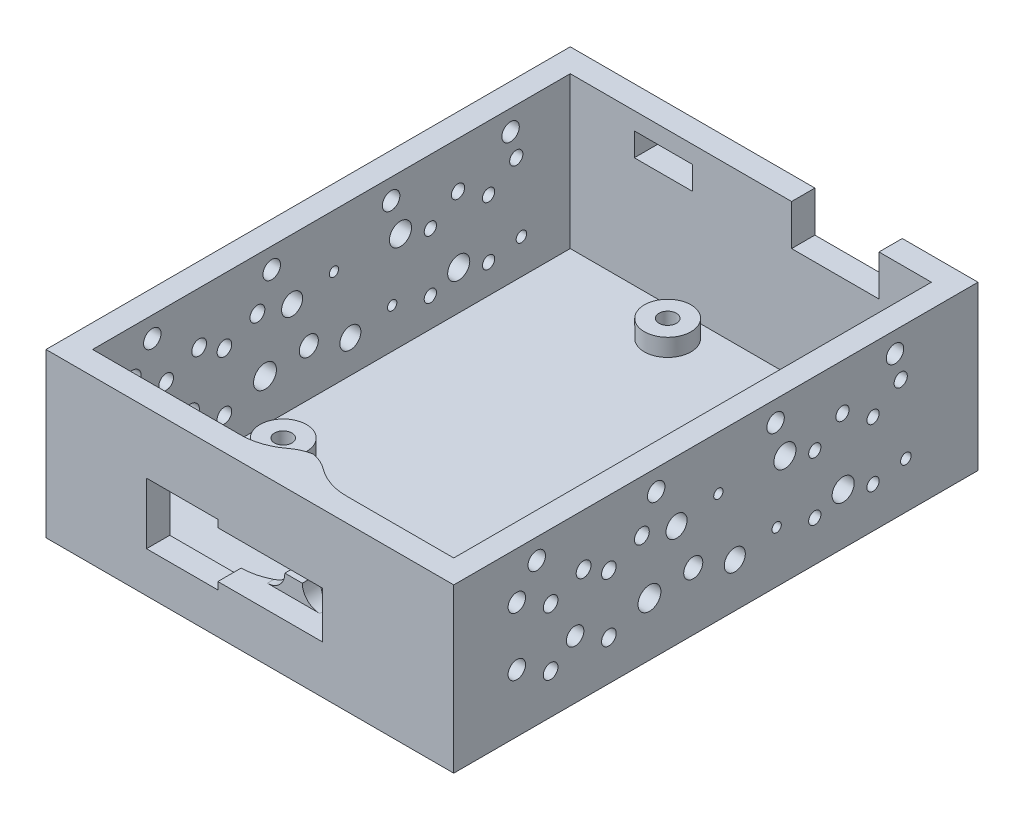
from build123d import *

# Parameters (mm, degrees)
SKETCH1_W               = 70
SKETCH1_H               = 90
BOSS_EXTRUDE1_DEPTH     = 30
SHELL1_T                = -4
SKETCH2_W               = 12.25
SKETCH2_H               = 10.5
CUT_EXTRUDE1_DEPTH      = 7
SKETCH3_W               = 18
SKETCH3_H               = 8
CUT_EXTRUDE2_DEPTH      = 7
SKETCH4_W               = 15
SKETCH4_H               = 7
CUT_EXTRUDE3_DEPTH      = 7
SKETCH6_R               = 4
SKETCH6_R_2             = 1.5
BOSS_EXTRUDE2_DEPTH     = 7
CUT_EXTRUDE4_DEPTH      = 86.32877592
CUT_EXTRUDE4_DEPTH_BACK = 86.32877592
SKETCH7_R               = 1.5
SKETCH8_W               = 10
SKETCH8_H               = 4
CUT_EXTRUDE5_DEPTH      = 7
SKETCH9_W               = 1.5
SKETCH9_H               = 3.5
BOSS_EXTRUDE3_DEPTH     = 26
SKETCH10_W              = 3
SKETCH10_H              = 2
CUT_EXTRUDE6_DEPTH      = 10
FILLET1_R               = 10
FILLET2_R               = 3
FILLET3_R               = 7
CHAMFER1_SIZE           = 2
CUT_EXTRUDE7_DEPTH      = 89.459030099
CUT_EXTRUDE7_DEPTH_BACK = 89.459030099
SKETCH11_R              = 1.5
SKETCH11_R_2            = 1.254212446
SKETCH11_R_3            = 1.273659443
SKETCH11_R_4            = 1.805040526
SKETCH11_R_5            = 0.799716356
SKETCH11_R_6            = 1.895584632
SKETCH11_R_7            = 1.051617441
SKETCH11_R_8            = 1.133111333
SKETCH11_R_9            = 1.963894901
SKETCH11_R_10           = 0.901694356
SKETCH11_R_11           = 1.635837407


with BuildPart() as part:
    # Sketch1 → Boss-Extrude1 (new body)
    with BuildSketch(Plane(origin=(0, 0, 0), x_dir=(1, 0, 0), z_dir=(0, 1, 0))):
        Rectangle(SKETCH1_W, SKETCH1_H)
    extrude(amount=BOSS_EXTRUDE1_DEPTH)

    # Shell1
    shell1_openings = [part.faces().sort_by_distance(p)[0] for p in [
        (0, 30, 0),
    ]]
    offset(amount=SHELL1_T, openings=shell1_openings, kind=Kind.INTERSECTION)

    # Sketch2 → Cut-Extrude1 (cut)
    with BuildSketch(Plane.XY.offset(45)):
        with Locations((-11.625, 14.25)):
            Rectangle(SKETCH2_W, SKETCH2_H)
    extrude(amount=-CUT_EXTRUDE1_DEPTH, mode=Mode.SUBTRACT)

    # Sketch3 → Cut-Extrude2 (cut)
    with BuildSketch(Plane.XY.offset(45)):
        with Locations((3.5, 14.25)):
            Rectangle(SKETCH3_W, SKETCH3_H)
    extrude(amount=-CUT_EXTRUDE2_DEPTH, mode=Mode.SUBTRACT)

    # Sketch4 → Cut-Extrude3 (cut)
    with BuildSketch(Plane(origin=(0, 0, -45), x_dir=(-1, 0, 0), z_dir=(0, 0, -1))):
        with Locations((-14.5, 26.5)):
            Rectangle(SKETCH4_W, SKETCH4_H)
    extrude(amount=-CUT_EXTRUDE3_DEPTH, mode=Mode.SUBTRACT)

    # Sketch6 → Boss-Extrude2 (add)
    # profile 1 of 4: a face of its own
    with BuildSketch(Plane(origin=(0, 0, -1.719487256), x_dir=(1, 0, 0), z_dir=(0, -1, 0))):
        with Locations(Location((-24.474103725, 16.519487256, 0), (0, 0, 270))):
            Circle(SKETCH6_R)
        with Locations(Location((-24.474103725, 16.519487256, 0), (0, 0, 270))):
            Circle(SKETCH6_R_2, mode=Mode.SUBTRACT)
    # profile 2 of 4: a face of its own
    with BuildSketch(Plane(origin=(0, 0, -1.719487256), x_dir=(1, 0, 0), z_dir=(0, -1, 0))):
        with Locations(Location((23.725896275, 17.819487256, 0), (0, 0, 270))):
            Circle(SKETCH6_R)
        with Locations(Location((23.725896275, 17.819487256, 0), (0, 0, 270))):
            Circle(SKETCH6_R_2, mode=Mode.SUBTRACT)
    # profile 3 of 4: a face of its own
    with BuildSketch(Plane(origin=(0, 0, -1.719487256), x_dir=(1, 0, 0), z_dir=(0, -1, 0))):
        with Locations(Location((18.625896275, -34.280512744, 0), (0, 0, 270))):
            Circle(SKETCH6_R)
        with Locations(Location((18.625896275, -34.280512744, 0), (0, 0, 270))):
            Circle(SKETCH6_R_2, mode=Mode.SUBTRACT)
    # profile 4 of 4: a face of its own
    with BuildSketch(Plane(origin=(0, 0, -1.719487256), x_dir=(1, 0, 0), z_dir=(0, -1, 0))):
        with Locations(Location((-9.274103725, -34.280512744, 0), (0, 0, 270))):
            Circle(SKETCH6_R)
        with Locations(Location((-9.274103725, -34.280512744, 0), (0, 0, 270))):
            Circle(SKETCH6_R_2, mode=Mode.SUBTRACT)
    extrude(amount=-BOSS_EXTRUDE2_DEPTH)

    # Sketch7 → Cut-Extrude4 (cut, two sides: drawn at the far end of the back side and taken through both)
    with BuildSketch(Plane.ZY.offset(-31).offset(-CUT_EXTRUDE4_DEPTH_BACK)):
        with Locations((-30.75, 26.5)):
            Circle(SKETCH7_R)
        with Locations((-10.25, 26.5)):
            Circle(SKETCH7_R)
        with Locations((10.25, 26.5)):
            Circle(SKETCH7_R)
        with Locations((30.75, 26.5)):
            Circle(SKETCH7_R)
    extrude(amount=CUT_EXTRUDE4_DEPTH + CUT_EXTRUDE4_DEPTH_BACK, mode=Mode.SUBTRACT)

    # Sketch8 → Cut-Extrude5 (cut)
    with BuildSketch(Plane(origin=(0, 0, -45), x_dir=(-1, 0, 0), z_dir=(0, 0, -1))):
        with Locations((15, 25)):
            Rectangle(SKETCH8_W, SKETCH8_H)
    extrude(amount=-CUT_EXTRUDE5_DEPTH, mode=Mode.SUBTRACT)

    # Sketch9 → Boss-Extrude3 (add)
    with BuildSketch(Plane(origin=(0, 4, 0), x_dir=(1, 0, 0), z_dir=(0, 1, 0))):
        with Locations((2.75, -39.25)):
            Rectangle(SKETCH9_W, SKETCH9_H)
        with Locations((4.25, -39.25)):
            Rectangle(SKETCH9_W, SKETCH9_H)
    extrude(amount=BOSS_EXTRUDE3_DEPTH)

    # Sketch10 → Cut-Extrude6 (cut)
    with BuildSketch(Plane.XY.offset(41)):
        with Locations((3.5, 14.25)):
            Rectangle(SKETCH10_W, SKETCH10_H)
    extrude(amount=-CUT_EXTRUDE6_DEPTH, mode=Mode.SUBTRACT)

    # Fillet1
    # the kernel refuses this fillet: 10 mm, written as the material it adds along each edge
    with BuildSketch(Plane(origin=(2, 4, 41), x_dir=(-1, 0, 0), z_dir=(0, 1, 0))) as fillet1_piece_1_section:
        with BuildLine():
            CenterArc((7.599342077, -10), FILLET1_R, 90, 49.458398126)
            Line((0, -3.5), (0, 0))
            Line((0, 0), (7.599342077, 0))
        make_face()
    fillet1_piece_1 = extrude(amount=25.248355192, mode=Mode.PRIVATE)
    fillet1_piece_1 = split(fillet1_piece_1, bisect_by=Plane(origin=(2, 9, 41), z_dir=(0, -1, 0)), keep=Keep.TOP, mode=Mode.PRIVATE)
    add(fillet1_piece_1)
    with BuildSketch(Plane(origin=(2, 4, 41), x_dir=(-1, 0, 0), z_dir=(0, 1, 0))) as fillet1_piece_2_section:
        with BuildLine():
            CenterArc((7.599342077, -10), FILLET1_R, 90, 49.458398126)
            Line((0, -3.5), (0, 0))
            Line((0, 0), (7.599342077, 0))
        make_face()
    fillet1_piece_2 = extrude(amount=6.25, mode=Mode.PRIVATE)
    fillet1_piece_2 = split(fillet1_piece_2, bisect_by=Plane(origin=(-5.5, 4, 41), z_dir=(1, 0, 0)), keep=Keep.TOP, mode=Mode.PRIVATE)
    add(fillet1_piece_2)
    with BuildSketch(Plane(origin=(2, -14.998355192, 41), x_dir=(-1, 0, 0), z_dir=(0, 1, 0))) as fillet1_piece_3_section:
        with BuildLine():
            CenterArc((7.599342077, -10), FILLET1_R, 90, 49.458398126)
            Line((0, -3.5), (0, 0))
            Line((0, 0), (7.599342077, 0))
        make_face()
    fillet1_piece_3 = extrude(amount=44.246710384, mode=Mode.PRIVATE)
    fillet1_piece_3 = split(fillet1_piece_3, bisect_by=Plane(origin=(-5.5, -14.998355192, 41), z_dir=(1, 0, 0)), keep=Keep.TOP, mode=Mode.PRIVATE)
    fillet1_piece_3 = split(fillet1_piece_3, bisect_by=Plane(origin=(2, 18.25, 41), z_dir=(0, 1, 0)), keep=Keep.TOP, mode=Mode.PRIVATE)
    add(fillet1_piece_3)
    with BuildSketch(Plane(origin=(2, -14.998355192, 41), x_dir=(-1, 0, 0), z_dir=(0, 1, 0))) as fillet1_piece_4_section:
        with BuildLine():
            CenterArc((7.599342077, -10), FILLET1_R, 90, 49.458398126)
            Line((0, -3.5), (0, 0))
            Line((0, 0), (7.599342077, 0))
        make_face()
    fillet1_piece_4 = extrude(amount=44.246710384, mode=Mode.PRIVATE)
    fillet1_piece_4 = split(fillet1_piece_4, bisect_by=Plane(origin=(2, 19.5, 41), z_dir=(0, 1, 0)), keep=Keep.TOP, mode=Mode.PRIVATE)
    add(fillet1_piece_4)
    with BuildSketch(Plane(origin=(2, -0.748355192, 41), x_dir=(-1, 0, 0), z_dir=(0, 1, 0))) as fillet1_piece_5_section:
        with BuildLine():
            CenterArc((7.599342077, -10), FILLET1_R, 90, 49.458398126)
            Line((0, -3.5), (0, 0))
            Line((0, 0), (7.599342077, 0))
        make_face()
    fillet1_piece_5 = extrude(amount=49.746710384, mode=Mode.PRIVATE)
    fillet1_piece_5 = split(fillet1_piece_5, bisect_by=Plane(origin=(2, 9, 41), z_dir=(0, -1, 0)), keep=Keep.TOP, mode=Mode.PRIVATE)
    fillet1_piece_5 = split(fillet1_piece_5, bisect_by=Plane(origin=(2, 4, 41), z_dir=(0, 1, 0)), keep=Keep.TOP, mode=Mode.PRIVATE)
    add(fillet1_piece_5)
    with BuildSketch(Plane(origin=(2, -0.748355192, 41), x_dir=(-1, 0, 0), z_dir=(0, 1, 0))) as fillet1_piece_6_section:
        with BuildLine():
            CenterArc((7.599342077, -10), FILLET1_R, 90, 49.458398126)
            Line((0, -3.5), (0, 0))
            Line((0, 0), (7.599342077, 0))
        make_face()
    fillet1_piece_6 = extrude(amount=49.746710384, mode=Mode.PRIVATE)
    fillet1_piece_6 = split(fillet1_piece_6, bisect_by=Plane(origin=(-5.5, -0.748355192, 41), z_dir=(1, 0, 0)), keep=Keep.TOP, mode=Mode.PRIVATE)
    fillet1_piece_6 = split(fillet1_piece_6, bisect_by=Plane(origin=(2, 10.25, 41), z_dir=(0, -1, 0)), keep=Keep.TOP, mode=Mode.PRIVATE)
    fillet1_piece_6 = split(fillet1_piece_6, bisect_by=Plane(origin=(2, 4, 41), z_dir=(0, 1, 0)), keep=Keep.TOP, mode=Mode.PRIVATE)
    add(fillet1_piece_6)
    with BuildSketch(Plane(origin=(2, 18.25, 41), x_dir=(-1, 0, 0), z_dir=(0, 1, 0))) as fillet1_piece_7_section:
        with BuildLine():
            CenterArc((7.599342077, -10), FILLET1_R, 90, 49.458398126)
            Line((0, -3.5), (0, 0))
            Line((0, 0), (7.599342077, 0))
        make_face()
    fillet1_piece_7 = extrude(amount=11.75, mode=Mode.PRIVATE)
    fillet1_piece_7 = split(fillet1_piece_7, bisect_by=Plane(origin=(-5.5, 18.25, 41), z_dir=(1, 0, 0)), keep=Keep.TOP, mode=Mode.PRIVATE)
    add(fillet1_piece_7)
    with BuildSketch(Plane(origin=(2, -0.748355192, 41), x_dir=(-1, 0, 0), z_dir=(0, 1, 0))) as fillet1_piece_8_section:
        with BuildLine():
            CenterArc((7.599342077, -10), FILLET1_R, 90, 49.458398126)
            Line((0, -3.5), (0, 0))
            Line((0, 0), (7.599342077, 0))
        make_face()
    fillet1_piece_8 = extrude(amount=30.748355192, mode=Mode.PRIVATE)
    fillet1_piece_8 = split(fillet1_piece_8, bisect_by=Plane(origin=(2, 19.5, 41), z_dir=(0, 1, 0)), keep=Keep.TOP, mode=Mode.PRIVATE)
    add(fillet1_piece_8)
    with BuildSketch(Plane(origin=(5, -0.748355192, 41), x_dir=(0, 0, -1), z_dir=(0, 1, 0))) as fillet1_piece_9_section:
        with BuildLine():
            CenterArc((10, -7.599342077), FILLET1_R, 130.541601874, 49.458398126)
            Line((0, -7.599342077), (0, 0))
            Line((0, 0), (3.5, 0))
        make_face()
    fillet1_piece_9 = extrude(amount=49.746710384, mode=Mode.PRIVATE)
    fillet1_piece_9 = split(fillet1_piece_9, bisect_by=Plane(origin=(5, 10.25, 41), z_dir=(0, -1, 0)), keep=Keep.TOP, mode=Mode.PRIVATE)
    fillet1_piece_9 = split(fillet1_piece_9, bisect_by=Plane(origin=(5, 4, 41), z_dir=(0, 1, 0)), keep=Keep.TOP, mode=Mode.PRIVATE)
    add(fillet1_piece_9)
    with BuildSketch(Plane(origin=(5, -0.748355192, 41), x_dir=(0, 0, -1), z_dir=(0, 1, 0))) as fillet1_piece_10_section:
        with BuildLine():
            CenterArc((10, -7.599342077), FILLET1_R, 130.541601874, 49.458398126)
            Line((0, -7.599342077), (0, 0))
            Line((0, 0), (3.5, 0))
        make_face()
    fillet1_piece_10 = extrude(amount=30.748355192, mode=Mode.PRIVATE)
    fillet1_piece_10 = split(fillet1_piece_10, bisect_by=Plane(origin=(12.5, -0.748355192, 41), z_dir=(1, 0, 0)), keep=Keep.TOP, mode=Mode.PRIVATE)
    fillet1_piece_10 = split(fillet1_piece_10, bisect_by=Plane(origin=(5, 4, 41), z_dir=(0, 1, 0)), keep=Keep.TOP, mode=Mode.PRIVATE)
    add(fillet1_piece_10)
    with BuildSketch(Plane(origin=(5, 18.25, 41), x_dir=(0, 0, -1), z_dir=(0, 1, 0))) as fillet1_piece_11:
        with BuildLine():
            CenterArc((10, -7.599342077), FILLET1_R, 130.541601874, 49.458398126)
            Line((0, -7.599342077), (0, 0))
            Line((0, 0), (3.5, 0))
        make_face()
    extrude(amount=11.75)
    with BuildSketch(Plane(origin=(5, 4, 41), x_dir=(1, 0, 0), z_dir=(0, 1, 0))) as fillet1_piece_12_section:
        with BuildLine():
            CenterArc((7.599342077, 10), FILLET1_R, 220.541601874, 49.458398126)
            Line((0, 3.5), (0, 0))
            Line((0, 0), (7.599342077, 0))
        make_face()
    fillet1_piece_12 = extrude(amount=25.248355192, mode=Mode.PRIVATE)
    fillet1_piece_12 = split(fillet1_piece_12, bisect_by=Plane(origin=(12.5, 4, 41), z_dir=(1, 0, 0)), keep=Keep.TOP, mode=Mode.PRIVATE)
    add(fillet1_piece_12)
    with BuildSketch(Plane(origin=(5, 4, 41), x_dir=(1, 0, 0), z_dir=(0, 1, 0))) as fillet1_piece_13:
        with BuildLine():
            CenterArc((7.599342077, 10), FILLET1_R, 220.541601874, 49.458398126)
            Line((0, 3.5), (0, 0))
            Line((0, 0), (7.599342077, 0))
        make_face()
    extrude(amount=6.25)
    with BuildSketch(Plane(origin=(5, -14.998355192, 41), x_dir=(1, 0, 0), z_dir=(0, 1, 0))) as fillet1_piece_14_section:
        with BuildLine():
            CenterArc((7.599342077, 10), FILLET1_R, 220.541601874, 49.458398126)
            Line((0, 3.5), (0, 0))
            Line((0, 0), (7.599342077, 0))
        make_face()
    fillet1_piece_14 = extrude(amount=44.246710384, mode=Mode.PRIVATE)
    fillet1_piece_14 = split(fillet1_piece_14, bisect_by=Plane(origin=(5, 18.25, 41), z_dir=(0, 1, 0)), keep=Keep.TOP, mode=Mode.PRIVATE)
    add(fillet1_piece_14)

    # Fillet2
    # the kernel refuses this fillet: 3 mm, written as the material it adds along each edge
    with BuildSketch(Plane(origin=(5, 18.25, 41), x_dir=(0, -1, 0), z_dir=(0, 0, -1))) as fillet2_piece_1_section:
        with BuildLine():
            CenterArc((FILLET2_R, -FILLET2_R), FILLET2_R, 90, 90)
            Line((0, -FILLET2_R), (0, 0))
            Line((0, 0), (FILLET2_R, 0))
        make_face()
    fillet2_piece_1 = extrude(amount=3.5, mode=Mode.PRIVATE)
    fillet2_piece_1 = fillet2_piece_1 - Plane(origin=(12.599342077, 18.25, 31), x_dir=(0, 0, -1), z_dir=(0, -1, 0)) * Cylinder(10, 19, mode=Mode.PRIVATE)
    add(fillet2_piece_1)
    with BuildSketch(Plane(origin=(2, 18.25, 37.5), x_dir=(0, -1, 0), z_dir=(0, 0, 1))) as fillet2_piece_2_section:
        with BuildLine():
            CenterArc((FILLET2_R, -FILLET2_R), FILLET2_R, 90, 90)
            Line((0, -FILLET2_R), (0, 0))
            Line((0, 0), (FILLET2_R, 0))
        make_face()
    fillet2_piece_2 = extrude(amount=3.5, mode=Mode.PRIVATE)
    fillet2_piece_2 = fillet2_piece_2 - Plane(origin=(-5.599342077, 18.25, 31), x_dir=(-1, 0, 0), z_dir=(0, -1, 0)) * Cylinder(10, 19, mode=Mode.PRIVATE)
    add(fillet2_piece_2)
    with BuildSketch(Plane(origin=(5, 10.25, 37.5), x_dir=(1, 0, 0), z_dir=(0, 0, 1))) as fillet2_piece_3_section:
        with BuildLine():
            CenterArc((FILLET2_R, FILLET2_R), FILLET2_R, 180, 90)
            Line((0, FILLET2_R), (0, 0))
            Line((0, 0), (FILLET2_R, 0))
        make_face()
    fillet2_piece_3 = extrude(amount=3.5, mode=Mode.PRIVATE)
    fillet2_piece_3 = fillet2_piece_3 - Plane(origin=(12.599342077, 10.25, 31), x_dir=(0, 0, -1), z_dir=(0, -1, 0)) * Cylinder(10, 19, mode=Mode.PRIVATE)
    add(fillet2_piece_3)
    with BuildSketch(Plane(origin=(2, 10.25, 37.5), x_dir=(-1, 0, 0), z_dir=(0, 0, 1))) as fillet2_piece_4_section:
        with BuildLine():
            CenterArc((FILLET2_R, -FILLET2_R), FILLET2_R, 90, 90)
            Line((0, -FILLET2_R), (0, 0))
            Line((0, 0), (FILLET2_R, 0))
        make_face()
    fillet2_piece_4 = extrude(amount=3.5, mode=Mode.PRIVATE)
    fillet2_piece_4 = fillet2_piece_4 - Plane(origin=(-5.599342077, 10.25, 31), x_dir=(-1, 0, 0), z_dir=(0, -1, 0)) * Cylinder(10, 19, mode=Mode.PRIVATE)
    add(fillet2_piece_4)

    # Fillet3
    # the kernel refuses this fillet: 7 mm, written as the material it takes off along each edge
    with BuildSketch(Plane(origin=(2, 36.831617708, 37.5), x_dir=(1, 0, 0), z_dir=(0, -1, 0)), Plane(origin=(5, 8.418382292, 37.5), x_dir=(-1, 0, 0), z_dir=(0, 1, 0))) as fillet3_piece_1:
        with BuildLine():
            CenterArc((2.732647083, 7), FILLET3_R, 232.571994457, 37.428005543)
            ThreePointArc((-1.521701394, 1.441176471), (-0.722990446, 0.760563907), (0, 0))
            Line((0, 0), (2.732647083, 0))
        make_face()
    extrude(amount=28.413235416, mode=Mode.SUBTRACT)
    with BuildSketch(Plane(origin=(5, 4, 37.5), x_dir=(-1, 0, 0), z_dir=(0, 1, 0)), Plane(origin=(2, 20.081617708, 37.5), x_dir=(1, 0, 0), z_dir=(0, -1, 0))) as fillet3_piece_2:
        with BuildLine():
            CenterArc((2.732647083, 7), FILLET3_R, 232.571994457, 37.428005543)
            ThreePointArc((-1.521701394, 1.441176471), (-0.722990446, 0.760563907), (0, 0))
            Line((0, 0), (2.732647083, 0))
        make_face()
    extrude(amount=16.081617708, mode=Mode.SUBTRACT)

    # Chamfer1
    chamfer1_edges = [part.edges().sort_by_distance(p)[0] for p in [
        (0, 0, 45),
        (-35, 0, 0),
        (0, 0, -45),
        (35, 0, 0),
    ]]
    chamfer(chamfer1_edges, length=CHAMFER1_SIZE)

    # Sketch11 → Cut-Extrude7 (cut, two sides: drawn at the far end of the back side and taken through both)
    with BuildSketch(Plane(origin=(35, 0, 0), x_dir=(0, 0, -1), z_dir=(1, 0, 0)).offset(-CUT_EXTRUDE7_DEPTH_BACK)):
        with Locations((-34.168963569, 21.993635488)):
            Circle(SKETCH11_R)
        with Locations((-28.369316722, 18.867201693)):
            Circle(SKETCH11_R_2)
        with Locations((-22.705469483, 21.168750965)):
            Circle(SKETCH11_R_3)
        with Locations((-6.748899624, 19.613094397)):
            Circle(SKETCH11_R_4)
        with Locations((0.430261537, 20.846618017)):
            Circle(SKETCH11_R_5)
        with Locations((11.853794128, 20.769901531)):
            Circle(SKETCH11_R_6)
        with Locations((16.981551342, 18.985320656)):
            Circle(SKETCH11_R_7)
        with Locations((21.733321831, 22.143716249)):
            Circle(SKETCH11_R_8)
        with Locations((-34.168963569, 11.993635488)):
            Circle(SKETCH11_R)
        with Locations((-28.369316722, 8.867201693)):
            Circle(SKETCH11_R_2)
        with Locations((-11.402014367, 11.238844406)):
            Circle(SKETCH11_R_9)
        with Locations((16.981551342, 8.985320656)):
            Circle(SKETCH11_R_7)
        with Locations((32.615064802, 9.970652535)):
            Circle(SKETCH11_R_10)
        with Locations((-24.168963569, 11.993635488)):
            Circle(SKETCH11_R)
        with Locations((-18.369316722, 8.867201693)):
            Circle(SKETCH11_R_2)
        with Locations((-3.883744182, 11.992226671)):
            Circle(SKETCH11_R_11)
        with Locations((3.251100376, 9.613094397)):
            Circle(SKETCH11_R_4)
        with Locations((10.430261537, 10.846618017)):
            Circle(SKETCH11_R_5)
        with Locations((21.853794128, 10.769901531)):
            Circle(SKETCH11_R_6)
        with Locations((26.981551342, 8.985320656)):
            Circle(SKETCH11_R_7)
        with Locations((-18.369316722, 18.867201693)):
            Circle(SKETCH11_R_2)
        with Locations((-12.705469483, 21.168750965)):
            Circle(SKETCH11_R_3)
        with Locations((26.981551342, 18.985320656)):
            Circle(SKETCH11_R_7)
        with Locations((31.733321831, 22.143716249)):
            Circle(SKETCH11_R_8)
    extrude(amount=CUT_EXTRUDE7_DEPTH + CUT_EXTRUDE7_DEPTH_BACK, mode=Mode.SUBTRACT)


solid = part.part
